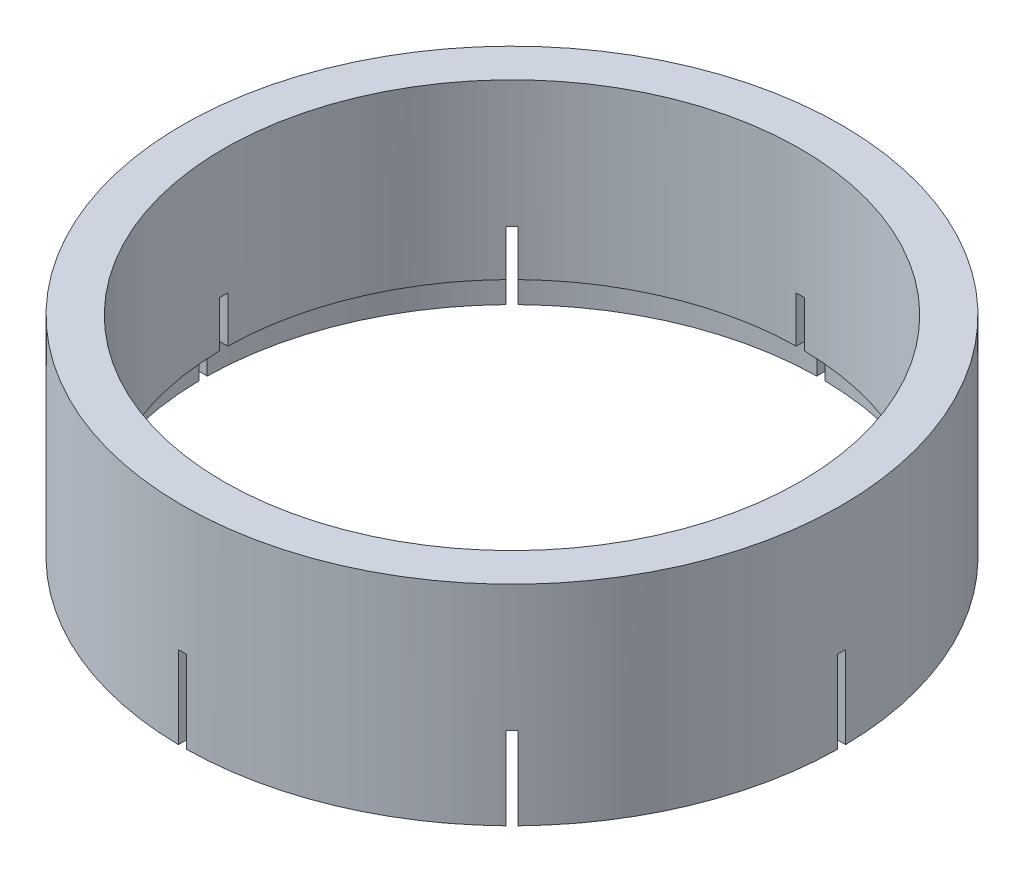
from build123d import *

# Parameters (mm, degrees)
SKETCH1_R           = 40
SKETCH1_R_2         = 35
BOSS_EXTRUDE1_DEPTH = 25.4
SKETCH2_R           = 37.5
SKETCH2_R_2         = 35
CUT_EXTRUDE1_DEPTH  = 4.4
SKETCH3_W           = 1
SKETCH3_H           = 10
CUT_EXTRUDE2_DEPTH  = 63.009354133
CIRPATTERN1_COUNT   = 4
CIRPATTERN1_ANGLE   = 135


with BuildPart() as part:
    # Sketch1 → Boss-Extrude1 (new body)
    with BuildSketch(Plane(origin=(0, 0, 0), x_dir=(1, 0, 0), z_dir=(0, 1, 0))):
        Circle(SKETCH1_R)
        Circle(SKETCH1_R_2, mode=Mode.SUBTRACT)
    extrude(amount=BOSS_EXTRUDE1_DEPTH)

    # Sketch2 → Cut-Extrude1 (cut)
    with BuildSketch(Plane.XZ):
        Circle(SKETCH2_R)
        Circle(SKETCH2_R_2, mode=Mode.SUBTRACT)
    extrude(amount=-CUT_EXTRUDE1_DEPTH, mode=Mode.SUBTRACT)

    # Sketch3 → Cut-Extrude2 (cut, symmetric)
    with BuildSketch(Plane.XY):
        with Locations((0, 5)):
            Rectangle(SKETCH3_W, SKETCH3_H)
    cut_extrude2 = extrude(amount=CUT_EXTRUDE2_DEPTH, both=True, mode=Mode.SUBTRACT)

    # CirPattern1: Cut-Extrude2 ×4 about axis
    cirpattern1_axis = Axis((0, 25.4, 0), (0, -1, 0))
    for i in range(1, CIRPATTERN1_COUNT):
        add(cut_extrude2.rotate(cirpattern1_axis, i * CIRPATTERN1_ANGLE / (CIRPATTERN1_COUNT - 1)), mode=Mode.SUBTRACT)


solid = part.part
